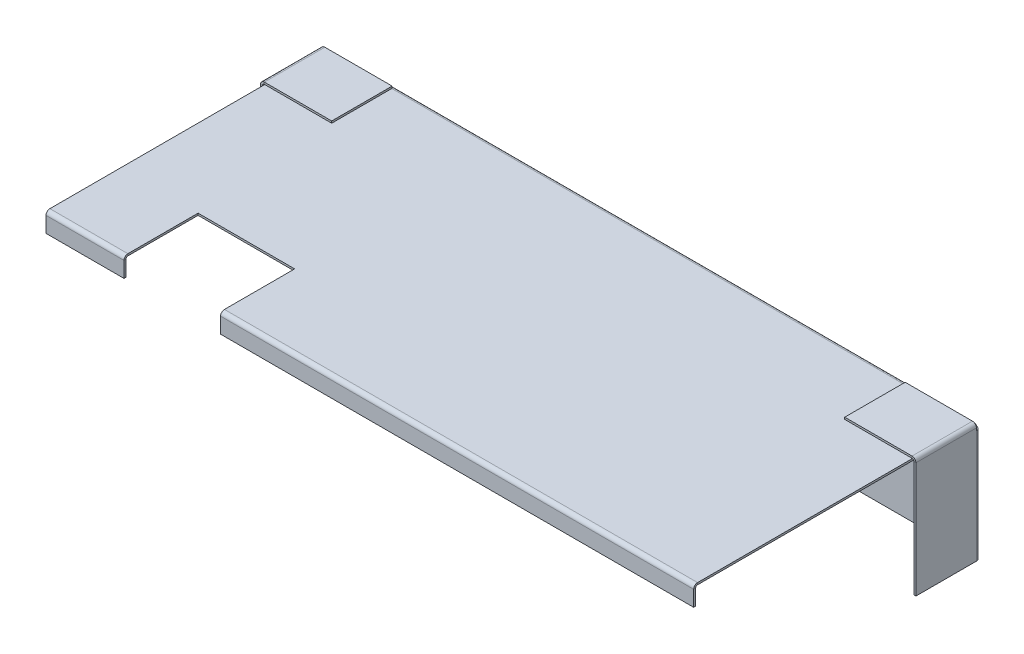
from build123d import *

# Parameters (mm, degrees)
SKETCH2_W                    = 210.920124673
SKETCH2_H                    = 90.17
BASE_FLANGE1_DEPTH           = 0.635
EDGE_FLANGE1_STRIP_W         = 3.81
EDGE_FLANGE1_STRIP_H         = 0.635
EDGE_FLANGE1_STRIP_CUT_DEPTH = 210.920124673
EDGE_FLANGE1_DEPTH           = 210.920124673
EDGE_FLANGE4_DEPTH           = 36.83
EDGE_FLANGE7_START           = -89.535
EDGE_FLANGE7_DEPTH           = 19.685
EDGE_FLANGE8_DEPTH           = 210.920124673
CUT_EXTRUDE1_REACH           = 235.927
SKETCH41_W                   = 31.449187445
SKETCH41_H                   = 25.469780901


# Read off the part's stored shape, not the designer's step: Edge-Flange7
# Sheet-metal steps are written as plain solids
with BuildPart() as part:
    # Sketch2 → Base-Flange1 (new body)
    with BuildSketch(Plane(origin=(0, 0, 0), x_dir=(1, 0, 0), z_dir=(0, 1, 0))):
        with Locations((105.460062337, 45.085)):
            Rectangle(SKETCH2_W, SKETCH2_H)
    extrude(amount=-BASE_FLANGE1_DEPTH)

    # Edge-Flange1 strip (across the edge) → Edge-Flange1 strip cut (cut)
    with BuildSketch(Plane(origin=(0, -0.635, -90.17), x_dir=(0, 0, 1), z_dir=(1, 0, 0))):
        with Locations((-1.27, -0.3175)):
            Rectangle(EDGE_FLANGE1_STRIP_W, EDGE_FLANGE1_STRIP_H)
    extrude(amount=EDGE_FLANGE1_STRIP_CUT_DEPTH, mode=Mode.SUBTRACT)

    # Edge-Flange1 section (across the edge) → Edge-Flange1 (add)
    with BuildSketch(Plane(origin=(0, -0.635, -90.17), x_dir=(0, 0, 1), z_dir=(1, 0, 0))):
        with BuildLine():
            Line((-0.635, 0.635), (-0.635, 37.465))
            Line((-0.635, 37.465), (0, 37.465))
            Line((0, 37.465), (0, 0.635))
            ThreePointArc((0, 0.635), (0.185987194, 0.185987194), (0.635, 0))
            Line((0.635, 0), (0.635, -0.635))
            ThreePointArc((0.635, -0.635), (-0.263025612, -0.263025612), (-0.635, 0.635))
        make_face()
    extrude(amount=EDGE_FLANGE1_DEPTH)

    # Edge-Flange4 section (across the edge) → Edge-Flange4 (add)
    with BuildSketch(Plane(origin=(211.555124673, -38.1, -90.17), x_dir=(-1, 0, 0), z_dir=(0, 1, 0))):
        with BuildLine():
            Line((-0.635, 0.635), (-0.635, 20.32))
            Line((-0.635, 20.32), (0, 20.32))
            Line((0, 20.32), (0, 0.635))
            ThreePointArc((0, 0.635), (0.185987194, 0.185987194), (0.635, 0))
            Line((0.635, 0), (0.635, -0.635))
            ThreePointArc((0.635, -0.635), (-0.263025612, -0.263025612), (-0.635, 0.635))
        make_face()
    edge_flange4 = extrude(amount=EDGE_FLANGE4_DEPTH)

    # Edge-Flange7 outline → Edge-Flange7 (add)
    with BuildSketch(Plane.XY.offset(EDGE_FLANGE7_START)):
        with BuildLine():
            ThreePointArc((212.190124673, -0.508), (211.818150285, 0.390025612), (210.920124673, 0.762))
            Line((210.920124673, 0.762), (188.995937227, 0.762))
            Line((188.995937227, 0.762), (188.995937227, 0.127))
            Line((188.995937227, 0.127), (210.920124673, 0.127))
            ThreePointArc((210.920124673, 0.127), (211.369137479, -0.058987194), (211.555124673, -0.508))
            Line((211.555124673, -0.508), (211.555124673, -1.27))
            Line((211.555124673, -1.27), (212.190124673, -1.27))
            Line((212.190124673, -1.27), (212.190124673, -0.508))
        make_face()
    edge_flange7 = extrude(amount=EDGE_FLANGE7_DEPTH)

    # Mirror1: Edge-Flange4, Edge-Flange7 across plane
    add(edge_flange4.mirror(Plane.ZY.offset(-105.460062336)))
    add(edge_flange7.mirror(Plane.ZY.offset(-105.460062336)))

    # Edge-Flange8 section (across the edge) → Edge-Flange8 (add)
    with BuildSketch(Plane(origin=(210.920124673, -0.635, 0.635), x_dir=(0, 0, -1), z_dir=(-1, 0, 0))):
        with BuildLine():
            Line((-0.635, 0.635), (-0.635, 5.715))
            Line((-0.635, 5.715), (0, 5.715))
            Line((0, 5.715), (0, 0.635))
            ThreePointArc((0, 0.635), (0.185987194, 0.185987194), (0.635, 0))
            Line((0.635, 0), (0.635, -0.635))
            ThreePointArc((0.635, -0.635), (-0.263025612, -0.263025612), (-0.635, 0.635))
        make_face()
    extrude(amount=EDGE_FLANGE8_DEPTH)

    # Sketch41 → Cut-Extrude1 (cut, up to next)
    with BuildSketch(Plane(origin=(0, 0, 0), x_dir=(1, 0, 0), z_dir=(0, 1, 0)), mode=Mode.PRIVATE) as cut_extrude1_sk1:
        with Locations((41.124593723, 10.12510955)):
            Rectangle(SKETCH41_W, SKETCH41_H)
    cut_extrude1_tool1 = extrude(cut_extrude1_sk1.sketch, amount=-CUT_EXTRUDE1_REACH, mode=Mode.PRIVATE) & part.part
    add(cut_extrude1_tool1.solids().sort_by_distance((41.124594, 0, -10.12511))[0], mode=Mode.SUBTRACT)


solid = part.part
